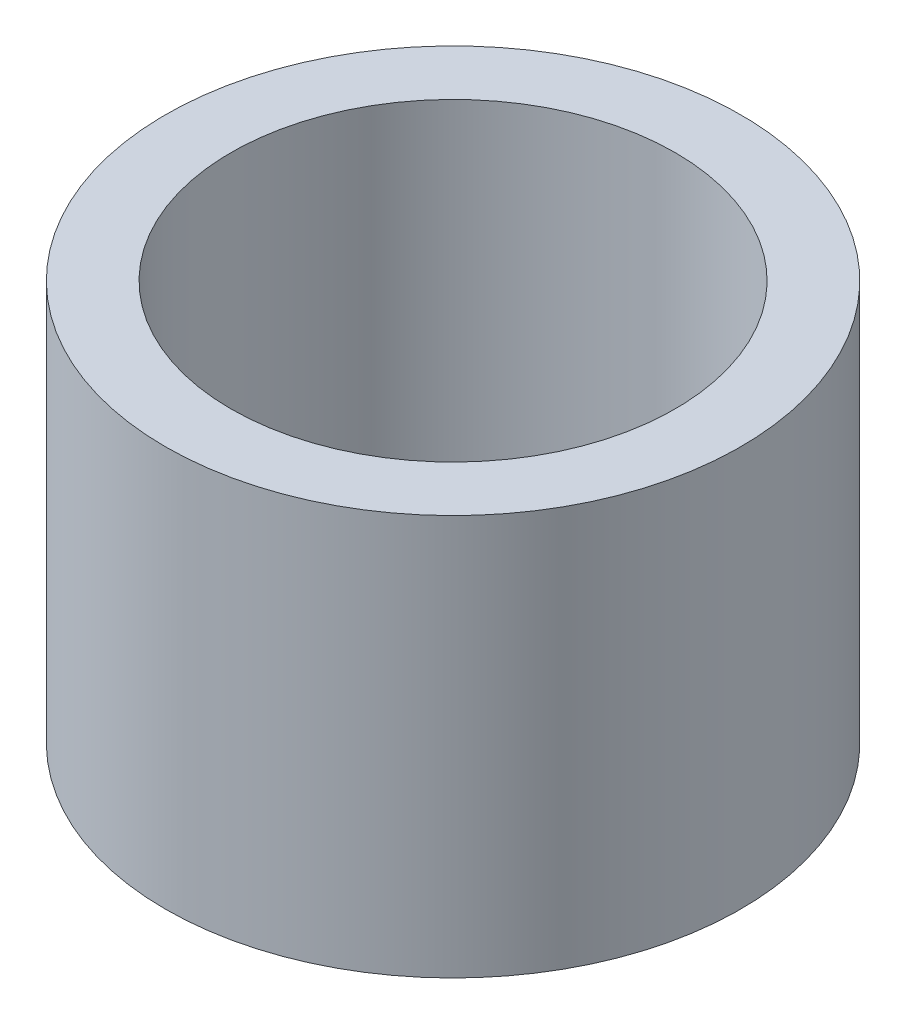
from build123d import *

# Parameters (mm, degrees)
SKETCH2_R           = 7.9
SKETCH2_R_2         = 6.1
BOSS_EXTRUDE1_DEPTH = 11


with BuildPart() as part:
    # Sketch2 → Boss-Extrude1 (new body)
    with BuildSketch(Plane(origin=(0, 0, 0), x_dir=(1, 0, 0), z_dir=(0, 1, 0))):
        Circle(SKETCH2_R)
        Circle(SKETCH2_R_2, mode=Mode.SUBTRACT)
    extrude(amount=BOSS_EXTRUDE1_DEPTH)


solid = part.part
